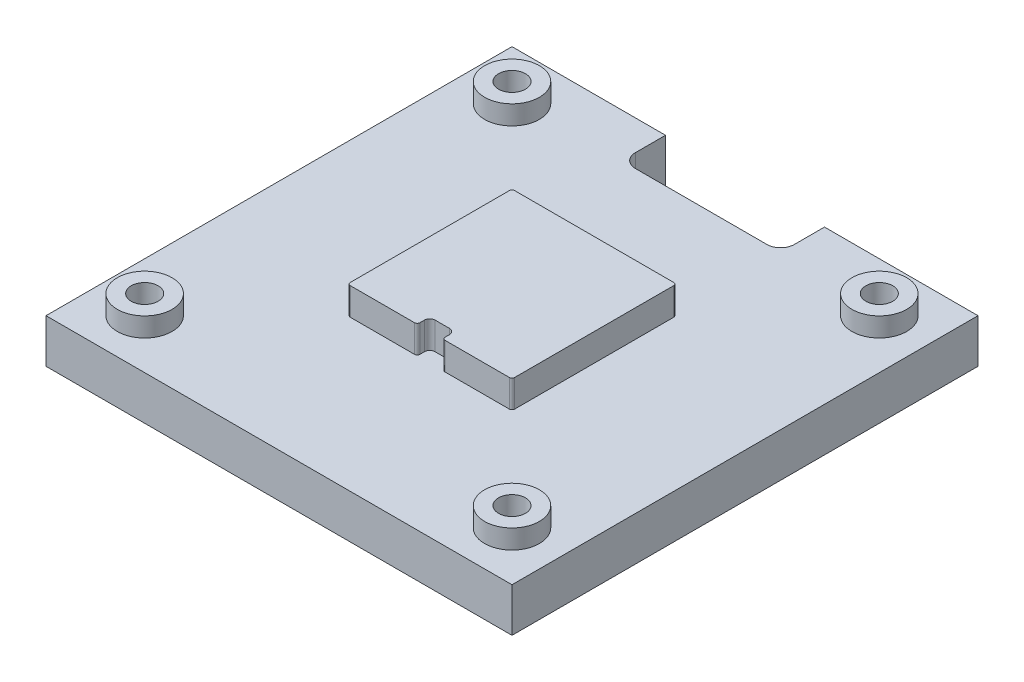
from build123d import *

# Parameters (mm, degrees)
SKETCH1_W           = 85
SKETCH1_H           = 85
SKETCH1_R           = 2.4575
BOSS_EXTRUDE1_DEPTH = 8
SKETCH2_R           = 3.969
CUT_EXTRUDE1_DEPTH  = 4.166
SKETCH3_R           = 5
SKETCH3_R_2         = 2.4575
BOSS_EXTRUDE2_DEPTH = 3.5
BOSS_EXTRUDE3_DEPTH = 5
SKETCH5_W           = 29
SKETCH5_H           = 8
CUT_EXTRUDE2_DEPTH  = 10
FILLET1_R           = 2.5


with BuildPart() as part:
    # Sketch1 → Boss-Extrude1 (new body)
    with BuildSketch(Plane(origin=(0, 0, 0), x_dir=(1, 0, 0), z_dir=(0, 1, 0))):
        Rectangle(SKETCH1_W, SKETCH1_H)
        with Locations((-33.5, 33.5)):
            Circle(SKETCH1_R, mode=Mode.SUBTRACT)
        with Locations((-33.5, -33.5)):
            Circle(SKETCH1_R, mode=Mode.SUBTRACT)
        with Locations((33.5, -33.5)):
            Circle(SKETCH1_R, mode=Mode.SUBTRACT)
        with Locations((33.5, 33.5)):
            Circle(SKETCH1_R, mode=Mode.SUBTRACT)
    extrude(amount=BOSS_EXTRUDE1_DEPTH)

    # Sketch2 → Cut-Extrude1 (cut)
    with BuildSketch(Plane.XZ):
        with Locations((-33.5, 33.5)):
            Circle(SKETCH2_R)
        with Locations((33.5, 33.5)):
            Circle(SKETCH2_R)
        with Locations((33.5, -33.5)):
            Circle(SKETCH2_R)
        with Locations((-33.5, -33.5)):
            Circle(SKETCH2_R)
    extrude(amount=-CUT_EXTRUDE1_DEPTH, mode=Mode.SUBTRACT)

    # Sketch3 → Boss-Extrude2 (add)
    # profile 1 of 4: a face of its own
    with BuildSketch(Plane(origin=(0, 8, 0), x_dir=(1, 0, 0), z_dir=(0, 1, 0))):
        with Locations((33.5, -33.5)):
            Circle(SKETCH3_R)
        with Locations((33.5, -33.5)):
            Circle(SKETCH3_R_2, mode=Mode.SUBTRACT)
    # profile 2 of 4: a face of its own
    with BuildSketch(Plane(origin=(0, 8, 0), x_dir=(1, 0, 0), z_dir=(0, 1, 0))):
        with Locations((-33.5, -33.5)):
            Circle(SKETCH3_R)
        with Locations((-33.5, -33.5)):
            Circle(SKETCH3_R_2, mode=Mode.SUBTRACT)
    # profile 3 of 4: a face of its own
    with BuildSketch(Plane(origin=(0, 8, 0), x_dir=(1, 0, 0), z_dir=(0, 1, 0))):
        with Locations((-33.5, 33.5)):
            Circle(SKETCH3_R)
        with Locations((-33.5, 33.5)):
            Circle(SKETCH3_R_2, mode=Mode.SUBTRACT)
    # profile 4 of 4: a face of its own
    with BuildSketch(Plane(origin=(0, 8, 0), x_dir=(1, 0, 0), z_dir=(0, 1, 0))):
        with Locations((33.5, 33.5)):
            Circle(SKETCH3_R)
        with Locations((33.5, 33.5)):
            Circle(SKETCH3_R_2, mode=Mode.SUBTRACT)
    extrude(amount=BOSS_EXTRUDE2_DEPTH)

    # Sketch4 → Boss-Extrude3 (add)
    with BuildSketch(Plane(origin=(0, 8, 0), x_dir=(1, 0, 0), z_dir=(0, 1, 0))):
        with BuildLine():
            Line((2.2929, -14.5), (2.2929, -13.7071))
            ThreePointArc((2.2929, -13.7071), (2.000006781, -12.999993219), (1.2929, -12.7071))
            Line((1.2929, -12.7071), (-1.2929, -12.7071))
            ThreePointArc((-1.2929, -12.7071), (-2.000006781, -12.999993219), (-2.2929, -13.7071))
            Line((-2.2929, -13.7071), (-2.2929, -14.5))
            ThreePointArc((-2.2929, -14.5), (-2.439346609, -14.853553391), (-2.7929, -15))
            Line((-2.7929, -15), (-14.5, -15))
            ThreePointArc((-14.5, -15), (-14.853553391, -14.853553391), (-15, -14.5))
            Line((-15, -14.5), (-15, 14.5))
            ThreePointArc((-15, 14.5), (-14.853553391, 14.853553391), (-14.5, 15))
            Line((-14.5, 15), (14.5, 15))
            ThreePointArc((14.5, 15), (14.853553391, 14.853553391), (15, 14.5))
            Line((15, 14.5), (15, -14.5))
            ThreePointArc((15, -14.5), (14.853553391, -14.853553391), (14.5, -15))
            Line((14.5, -15), (2.7929, -15))
            ThreePointArc((2.7929, -15), (2.439346609, -14.853553391), (2.2929, -14.5))
        make_face()
    extrude(amount=BOSS_EXTRUDE3_DEPTH)

    # Sketch5 → Cut-Extrude2 (cut)
    with BuildSketch(Plane(origin=(0, 8, 0), x_dir=(1, 0, 0), z_dir=(0, 1, 0))):
        with Locations((0, 38.5)):
            Rectangle(SKETCH5_W, SKETCH5_H)
    extrude(amount=-CUT_EXTRUDE2_DEPTH, mode=Mode.SUBTRACT)

    # Fillet1
    fillet1_edges = [part.edges().sort_by_distance(p)[0] for p in [
        (-14.5, 4, -34.5),
        (14.5, 4, -34.5),
    ]]
    fillet(fillet1_edges, radius=FILLET1_R)


solid = part.part
